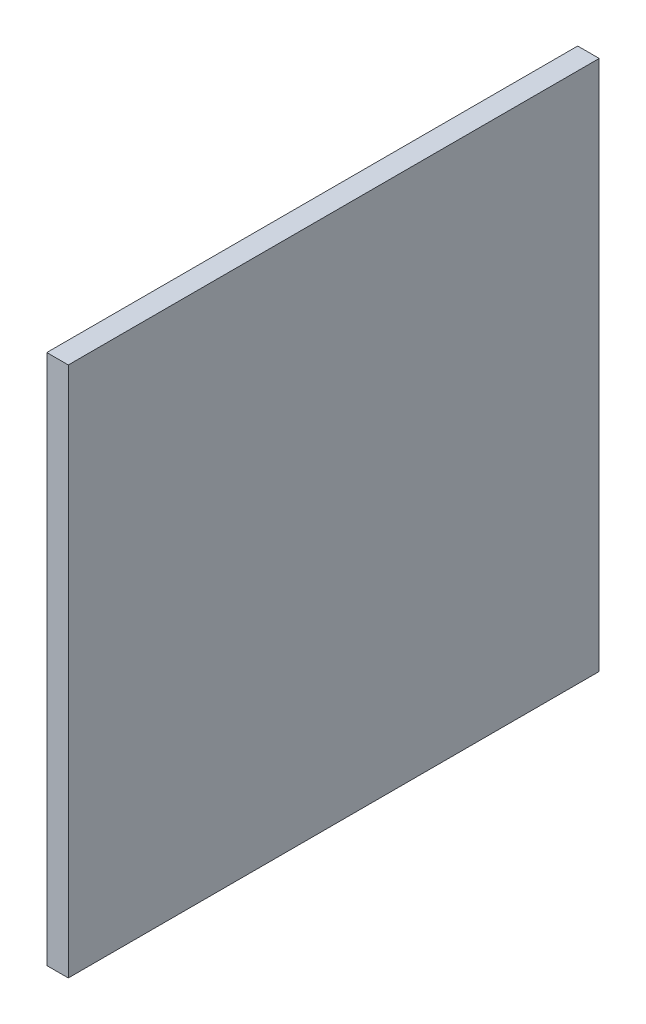
from build123d import *

# Parameters (mm, degrees)
SKETCH1_W          = 74
SKETCH1_H          = 74
BASE_FLANGE1_DEPTH = 3


# Sheet-metal steps are written as plain solids
with BuildPart() as part:
    # Sketch1 → Base-Flange1 (new body)
    with BuildSketch(Plane(origin=(0, 0, 0), x_dir=(0, 0, -1), z_dir=(1, 0, 0))):
        Rectangle(SKETCH1_W, SKETCH1_H)
    extrude(amount=-BASE_FLANGE1_DEPTH)


solid = part.part
